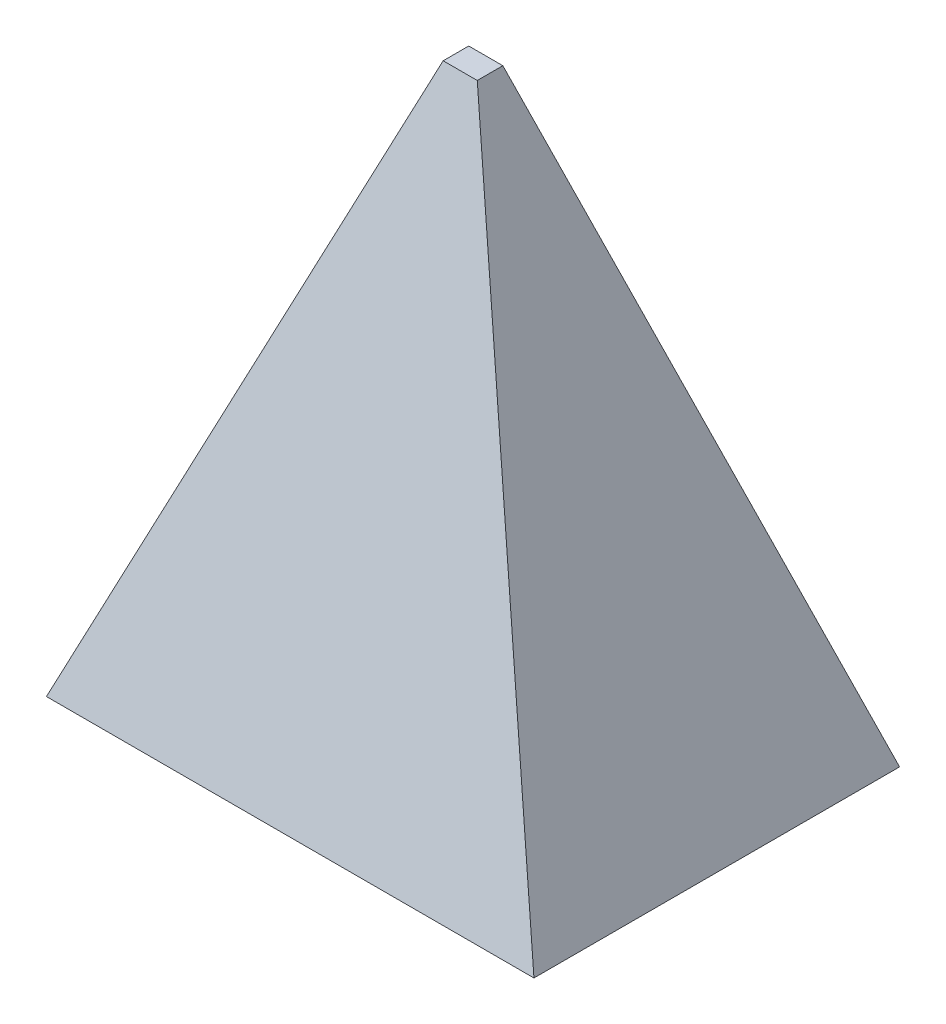
from build123d import *


with BuildPart() as part:
    # Sketch1 → FOV section 0
    with BuildSketch(Plane(origin=(0, 0, 0), x_dir=(1, 0, 0), z_dir=(0, 1, 0))):
        with BuildLine():
            Line((-50.8, -38.1), (50.8, -38.1))
            Line((50.8, -38.1), (50.8, 38.1))
            Line((50.8, 38.1), (-50.8, 38.1))
            Line((-50.8, 38.1), (-50.8, -38.1))
        make_face()
    # Sketch2 → FOV section 1
    with BuildSketch(Plane(origin=(0, 120.65, 0), x_dir=(1, 0, 0), z_dir=(0, 1, 0))):
        with BuildLine():
            Line((-3.553455198, -2.665091399), (3.553455198, -2.665091399))
            Line((3.553455198, -2.665091399), (3.553455198, 2.665091399))
            Line((3.553455198, 2.665091399), (-3.553455198, 2.665091399))
            Line((-3.553455198, 2.665091399), (-3.553455198, -2.665091399))
        make_face()
    loft()


solid = part.part
